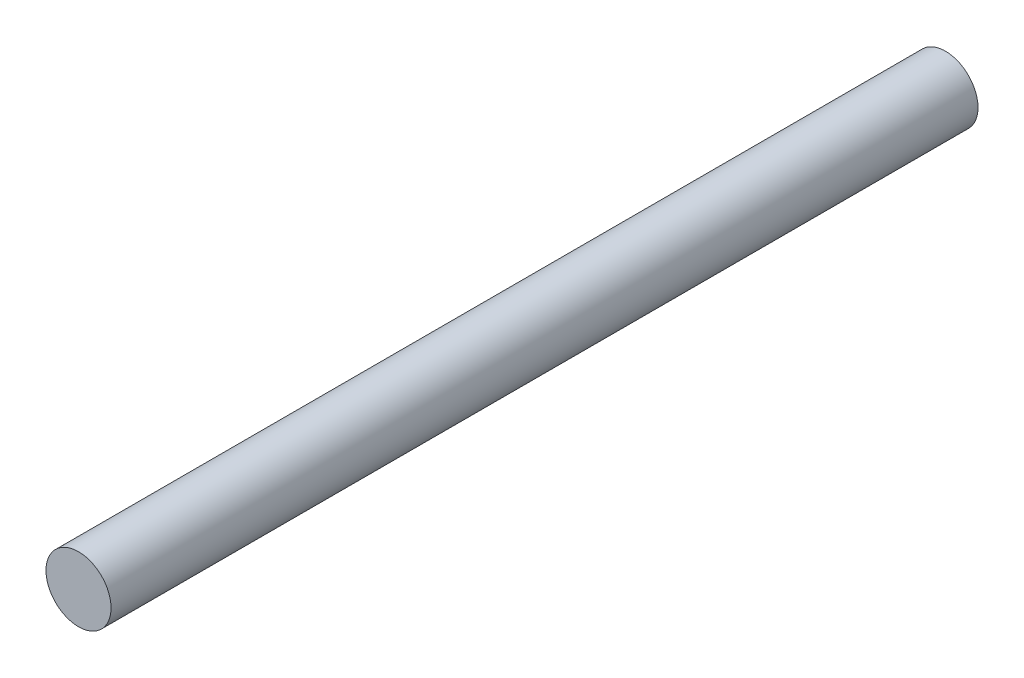
from build123d import *

# Parameters (mm, degrees)
BOSS_EXTRUDE1_OUTLINE_R = 6.35
BOSS_EXTRUDE1_DEPTH     = 169.27068


# Read off the part's stored shape, not the designer's step: Boss-Extrude1
with BuildPart() as part:
    # Boss-Extrude1 outline → Boss-Extrude1 (new body)
    with BuildSketch(Plane(origin=(0, 0, 146.41068), x_dir=(-1, 0, 0), z_dir=(0, 0, -1))):
        with Locations((-36.068, 0)):
            Circle(BOSS_EXTRUDE1_OUTLINE_R)
    extrude(amount=BOSS_EXTRUDE1_DEPTH)


solid = part.part
